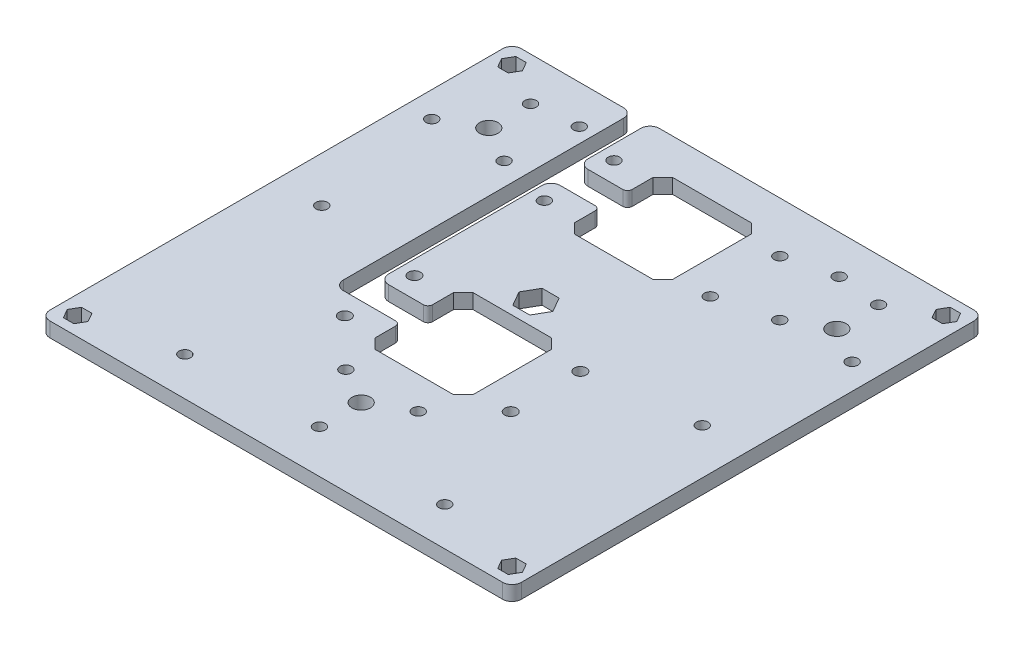
from build123d import *

# Parameters (mm, degrees)
ESQUISSE1_W                  = 203.2
ESQUISSE1_H                  = 203.2
BOSS_EXTRU_1_DEPTH           = 6.35
ESQUISSE2_R                  = 4
ENL_V_MAT_EXTRU_1_DEPTH      = 144.824345992
ENL_V_MAT_EXTRU_2_DEPTH      = 144.824345992
ESQUISSE5_R                  = 2.5
ENL_V_MAT_EXTRU_4_DEPTH      = 144.824345992
ESQUISSE6_R                  = 2.5
ENL_V_MAT_EXTRU_5_DEPTH      = 144.824345992
ENL_V_MAT_EXTRU_6_DEPTH      = 144.824345992
ENL_V_MAT_EXTRU_6_DEPTH_BACK = 144.824345992
ESQUISSE8_R                  = 2.5
ENL_V_MAT_EXTRU_7_DEPTH      = 144.824345992
ENL_V_MAT_EXTRU_8_DEPTH      = 144.824345992
ESQUISSE10_R                 = 2.5
ENL_V_MAT_EXTRU_9_DEPTH      = 144.824345992
ENL_V_MAT_EXTRU_11_DEPTH     = 144.824345992
ENL_V_MAT_EXTRU_10_DEPTH     = 144.824345992
CONG_1_R                     = 4
CONG_2_R                     = 2
ESQUISSE16_R                 = 2.6
ENL_V_MAT_EXTRU_12_DEPTH     = 144.824345992


with BuildPart() as part:
    # Esquisse1 → Boss.-Extru.1 (new body)
    with BuildSketch(Plane(origin=(0, 0, 0), x_dir=(1, 0, 0), z_dir=(0, 1, 0))):
        Rectangle(ESQUISSE1_W, ESQUISSE1_H)
    extrude(amount=BOSS_EXTRU_1_DEPTH)

    # Esquisse2 → Enlèv. mat.-Extru.1 (cut, through all)
    with BuildSketch(Plane(origin=(0, 6.35, 0), x_dir=(1, 0, 0), z_dir=(0, 1, 0))):
        with Locations((-75, 65)):
            Circle(ESQUISSE2_R)
        with Locations((75, 65)):
            Circle(ESQUISSE2_R)
        with Locations((0, -65)):
            Circle(ESQUISSE2_R)
    extrude(amount=-ENL_V_MAT_EXTRU_1_DEPTH, mode=Mode.SUBTRACT)

    # Esquisse3 → Enlèv. mat.-Extru.2 (cut, through all)
    with BuildSketch(Plane(origin=(0, 6.35, 0), x_dir=(1, 0, 0), z_dir=(0, 1, 0))):
        Polygon((-16.978069991, 86.15), (-21.15, 81.978069991), (-21.15, 48.021930009), (-16.978069991, 43.85), (16.978069991, 43.85), (21.15, 48.021930009), (21.15, 81.978069991), (16.978069991, 86.15), align=None)
    extrude(amount=-ENL_V_MAT_EXTRU_2_DEPTH, mode=Mode.SUBTRACT)

    # Esquisse5 → Enlèv. mat.-Extru.4 (cut, through all)
    with BuildSketch(Plane(origin=(0, 6.35, 0), x_dir=(1, 0, 0), z_dir=(0, 1, 0))):
        with Locations((-35.9, 49.85)):
            Circle(ESQUISSE5_R)
        with Locations((-35.9, 79.85)):
            Circle(ESQUISSE5_R)
        with Locations((35.6, 79.85)):
            Circle(ESQUISSE5_R)
        with Locations((35.6, 49.85)):
            Circle(ESQUISSE5_R)
    extrude(amount=-ENL_V_MAT_EXTRU_4_DEPTH, mode=Mode.SUBTRACT)

    # Esquisse6 → Enlèv. mat.-Extru.5 (cut, through all)
    with BuildSketch(Plane(origin=(0, 6.35, 0), x_dir=(1, 0, 0), z_dir=(0, 1, 0))):
        with Locations((93.6, -93.6)):
            Circle(ESQUISSE6_R)
        with Locations((-93.6, -93.6)):
            Circle(ESQUISSE6_R)
        with Locations((-93.6, 93.6)):
            Circle(ESQUISSE6_R)
        with Locations((93.6, 93.6)):
            Circle(ESQUISSE6_R)
    extrude(amount=-ENL_V_MAT_EXTRU_5_DEPTH, mode=Mode.SUBTRACT)

    # Esquisse7 → Enlèv. mat.-Extru.6 (cut, two sides: drawn at the far end of the back side and taken through both)
    with BuildSketch(Plane(origin=(0, 6.35, 0), x_dir=(1, 0, 0), z_dir=(0, 1, 0)).offset(-ENL_V_MAT_EXTRU_6_DEPTH_BACK)):
        Polygon((-98.1033321, -93.6), (-95.85166605, -97.5), (-91.34833395, -97.5), (-89.0966679, -93.6), (-91.34833395, -89.7), (-95.85166605, -89.7), align=None)
        Polygon((89.0966679, -93.6), (91.34833395, -97.5), (95.85166605, -97.5), (98.1033321, -93.6), (95.85166605, -89.7), (91.34833395, -89.7), align=None)
        Polygon((89.0966679, 93.6), (91.34833395, 89.7), (95.85166605, 89.7), (98.1033321, 93.6), (95.85166605, 97.5), (91.34833395, 97.5), align=None)
        Polygon((-98.1033321, 93.6), (-95.85166605, 89.7), (-91.34833395, 89.7), (-89.0966679, 93.6), (-91.34833395, 97.5), (-95.85166605, 97.5), align=None)
    extrude(amount=ENL_V_MAT_EXTRU_6_DEPTH + ENL_V_MAT_EXTRU_6_DEPTH_BACK, mode=Mode.SUBTRACT)

    # Esquisse8 → Enlèv. mat.-Extru.7 (cut, through all)
    with BuildSketch(Plane(origin=(0, 6.35, 0), x_dir=(1, 0, 0), z_dir=(0, 1, 0))):
        with Locations((90.588457268, 56)):
            Circle(ESQUISSE8_R)
        with Locations((59.411542732, 56)):
            Circle(ESQUISSE8_R)
        with Locations((75, 83)):
            Circle(ESQUISSE8_R)
        with Locations((-90.589923123, 55.999154304)):
            Circle(ESQUISSE8_R)
        with Locations((-75.001465855, 82.999154304)):
            Circle(ESQUISSE8_R)
        with Locations((-59.413008586, 55.999154304)):
            Circle(ESQUISSE8_R)
        with Locations((-15.588457268, -56)):
            Circle(ESQUISSE8_R)
        with Locations((15.588457268, -56)):
            Circle(ESQUISSE8_R)
        with Locations((0, -83)):
            Circle(ESQUISSE8_R)
    extrude(amount=-ENL_V_MAT_EXTRU_7_DEPTH, mode=Mode.SUBTRACT)

    # Esquisse9 → Enlèv. mat.-Extru.8 (cut, through all)
    with BuildSketch(Plane(origin=(0, 6.35, 0), x_dir=(1, 0, 0), z_dir=(0, 1, 0))):
        Polygon((-7.303480905, 10.325), (-3.651740453, 4), (3.651740453, 4), (7.303480905, 10.325), (3.651740453, 16.65), (-3.651740453, 16.65), align=None)
    extrude(amount=-ENL_V_MAT_EXTRU_8_DEPTH, mode=Mode.SUBTRACT)

    # Esquisse10 → Enlèv. mat.-Extru.9 (cut, through all)
    with BuildSketch(Plane.XZ):
        with Locations((56, -85)):
            Circle(ESQUISSE10_R)
        with Locations((82, 0)):
            Circle(ESQUISSE10_R)
        with Locations((56, 85)):
            Circle(ESQUISSE10_R)
    enl_v_mat_extru_9 = extrude(amount=-ENL_V_MAT_EXTRU_9_DEPTH, mode=Mode.SUBTRACT)

    # Symétrie1: Enlèv. mat.-Extru.9 across plane
    add(enl_v_mat_extru_9.mirror(Plane(origin=(0, 0, 0), x_dir=(0, 0, 1), z_dir=(1, 0, 0))), mode=Mode.SUBTRACT)

    # Esquisse13 → Enlèv. mat.-Extru.11 (cut, through all)
    with BuildSketch(Plane(origin=(0, 6.35, 0), x_dir=(1, 0, 0), z_dir=(0, 1, 0))):
        Polygon((16.978069991, -42.150000003), (21.15, -37.978069994), (21.15, -4.021930012), (16.978069991, 0.149999997), (-16.978069991, 0.149999997), (-21.15, -4.021930012), (-21.15, -37.978069994), (-16.978069991, -42.150000003), align=None)
    extrude(amount=-ENL_V_MAT_EXTRU_11_DEPTH, mode=Mode.SUBTRACT)

    # Esquisse11 → Enlèv. mat.-Extru.10 (cut, through all)
    with BuildSketch(Plane(origin=(0, 6.35, 0), x_dir=(1, 0, 0), z_dir=(0, 1, 0))):
        Polygon((-21.15, 58.928069991), (-42.1, 58.928069991), (-42.1, -15.071930012), (-21.15, -15.071930012), (-21.15, -27.071930012), (-49.6, -27.071930012), (-49.6, -15.071930012), (-49.6, 58.928069991), (-49.6, 101.6), (-42.1, 101.6), (-42.1, 70.928069991), (-21.15, 70.928069991), align=None)
    extrude(amount=-ENL_V_MAT_EXTRU_10_DEPTH, mode=Mode.SUBTRACT)

    # Congé1
    cong_1_edges = [part.edges().sort_by_distance(p)[0] for p in [
        (-42.1, 3.175, -101.6),
        (-49.6, 3.175, -101.6),
        (-42.1, 3.175, -70.928069991),
        (-101.6, 3.175, 101.6),
        (101.6, 3.175, 101.6),
        (101.6, 3.175, -101.6),
        (-101.6, 3.175, -101.6),
        (-49.6, 3.175, 27.071930012),
        (-42.1, 3.175, 15.071930012),
        (-42.1, 3.175, -58.928069991),
    ]]
    fillet(cong_1_edges, radius=CONG_1_R)

    # Congé2
    cong_2_edges = [part.edges().sort_by_distance(p)[0] for p in [
        (-21.15, 3.175, -58.928069991),
        (-21.15, 3.175, -70.928069991),
        (-21.15, 3.175, 27.071930012),
        (-21.15, 3.175, 15.071930012),
    ]]
    fillet(cong_2_edges, radius=CONG_2_R)

    # Esquisse16 → Enlèv. mat.-Extru.12 (cut, through all)
    with BuildSketch(Plane(origin=(0, 6.35, 0), x_dir=(1, 0, 0), z_dir=(0, 1, 0))):
        with Locations((35.6, -36.15)):
            Circle(ESQUISSE16_R)
        with Locations((35.6, -6.15)):
            Circle(ESQUISSE16_R)
        with Locations((-35.9, -6.15)):
            Circle(ESQUISSE16_R)
        with Locations((-35.9, -36.15)):
            Circle(ESQUISSE16_R)
    extrude(amount=-ENL_V_MAT_EXTRU_12_DEPTH, mode=Mode.SUBTRACT)


solid = part.part
